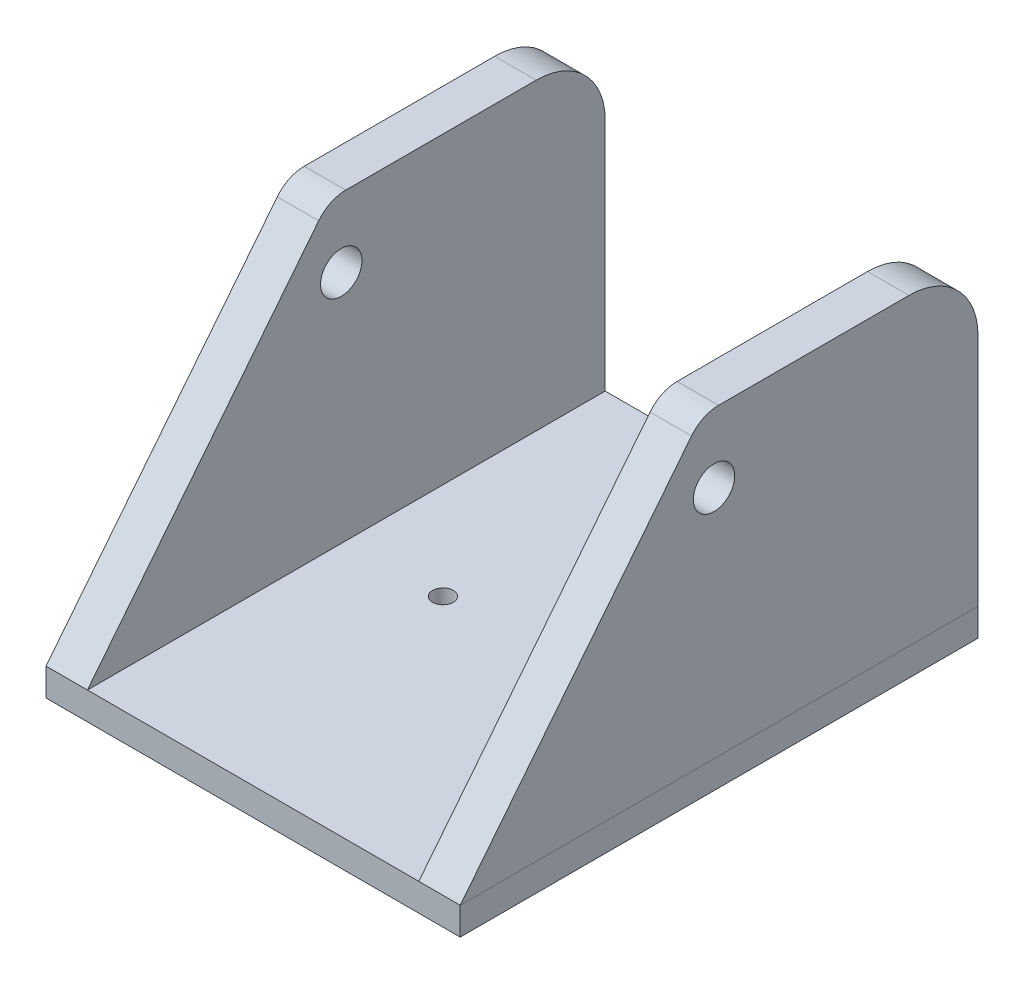
from build123d import *

# Parameters (mm, degrees)
SKETCH1_W               = 60
SKETCH1_H               = 75
BOSS_EXTRUDE1_DEPTH     = 4
CUT_EXTRUDE1_DEPTH      = 81.876448982
CUT_EXTRUDE1_DEPTH_BACK = 4
SKETCH2_R               = 1.5
SKETCH8_R               = 3
CUT_EXTRUDE2_DEPTH      = 74
FILLET3_R               = 5
FILLET4_R               = 10
SPLIT1_START            = 4
SPLIT1_OUTLINE_W        = 6
SPLIT1_OUTLINE_H        = 76
SPLIT1_DEPTH            = 44
SPLIT1_START_2          = -30
SPLIT1_2_OUTLINE_R      = 3
SPLIT1_2_DEPTH          = 6
SPLIT1_START_3          = 24
SPLIT1_3_OUTLINE_R      = 3
SPLIT1_3_DEPTH          = 6


# Read off the part's stored shape, not the designer's step: Split1
with BuildPart() as part:
    # Sketch1 → Boss-Extrude1 (new body)
    with BuildSketch(Plane(origin=(0, 0, 0), x_dir=(1, 0, 0), z_dir=(0, 1, 0))):
        with Locations((0, 37.5)):
            Rectangle(SKETCH1_W, SKETCH1_H)
    extrude(amount=BOSS_EXTRUDE1_DEPTH)

    # Sketch2 → Cut-Extrude1 (cut, two sides: drawn at the far end of the back side and taken through both)
    with BuildSketch(Plane(origin=(0, 4, 0), x_dir=(1, 0, 0), z_dir=(0, 1, 0)).offset(-CUT_EXTRUDE1_DEPTH_BACK)):
        with Locations(Location((-10, 37.5, 0), (0, 0, 90))):
            Circle(SKETCH2_R)
        with Locations(Location((10, 37.5, 0), (0, 0, 90))):
            Circle(SKETCH2_R)
    extrude(amount=CUT_EXTRUDE1_DEPTH + CUT_EXTRUDE1_DEPTH_BACK, mode=Mode.SUBTRACT)

    # Sketch3 → Loft1 section 0
    with BuildSketch(Plane(origin=(0, 4, 0), x_dir=(1, 0, 0), z_dir=(0, 1, 0))):
        with BuildLine():
            Line((30, 75), (24, 75))
            Line((24, 75), (24, 0))
            Line((24, 0), (30, 0))
            Line((30, 0), (30, 75))
        make_face()
    # Sketch4 → Loft1 section 1
    with BuildSketch(Plane(origin=(0, 48, 0), x_dir=(1, 0, 0), z_dir=(0, 1, 0))):
        with BuildLine():
            Line((24, 75), (24, 35))
            Line((24, 35), (30, 35))
            Line((30, 35), (30, 75))
            Line((30, 75), (24, 75))
        make_face()
    loft()

    # Sketch3<19> → Loft2 section 0
    with BuildSketch(Plane(origin=(0, 4, 0), x_dir=(1, 0, 0), z_dir=(0, 1, 0))):
        with BuildLine():
            Line((-30, 75), (-24, 75))
            Line((-24, 75), (-24, 0))
            Line((-24, 0), (-30, 0))
            Line((-30, 0), (-30, 75))
        make_face()
    # Sketch4<17> → Loft2 section 1
    with BuildSketch(Plane(origin=(0, 48, 0), x_dir=(1, 0, 0), z_dir=(0, 1, 0))):
        with BuildLine():
            Line((-24, 75), (-24, 35))
            Line((-24, 35), (-30, 35))
            Line((-30, 35), (-30, 75))
            Line((-30, 75), (-24, 75))
        make_face()
    loft()

    # Sketch8 → Cut-Extrude2 (cut)
    with BuildSketch(Plane.ZY.offset(30)):
        with Locations((-36.766552642, 38)):
            Circle(SKETCH8_R)
    extrude(amount=-CUT_EXTRUDE2_DEPTH, mode=Mode.SUBTRACT)

    # Fillet3
    fillet3_edges = [part.edges().sort_by_distance(p)[0] for p in [
        (27, 48, -35),
        (-27, 48, -35),
    ]]
    fillet(fillet3_edges, radius=FILLET3_R)

    # Fillet4
    fillet4_edges = [part.edges().sort_by_distance(p)[0] for p in [
        (-27, 48, -75),
        (27, 48, -75),
    ]]
    fillet(fillet4_edges, radius=FILLET4_R)

    # Split1 outline → Split1 (cut)
    with BuildSketch(Plane(origin=(0, 0, 0), x_dir=(1, 0, 0), z_dir=(0, 1, 0)).offset(SPLIT1_START)):
        with Locations((-27, 37)):
            Rectangle(SPLIT1_OUTLINE_W, SPLIT1_OUTLINE_H)
        with Locations((27, 37)):
            Rectangle(SPLIT1_OUTLINE_W, SPLIT1_OUTLINE_H)
    extrude(amount=SPLIT1_DEPTH, mode=Mode.SUBTRACT)


with BuildPart() as body_2:
    # Split1 2 outline → Split1 2 (new body)
    with BuildSketch(Plane.YZ.offset(SPLIT1_START_2)):
        with BuildLine():
            Line((4, 0), (4, -75))
            Line((4, -75), (38, -75))
            ThreePointArc((38, -75), (45.071067812, -72.071067812), (48, -65))
            Line((48, -65), (48, -37.411678544))
            ThreePointArc((48, -37.411678544), (47.503503589, -35.239477948), (46.112617829, -33.498673273))
            Line((46.112617829, -33.498673273), (4, 0))
        make_face()
        with Locations((38, -36.766552642)):
            Circle(SPLIT1_2_OUTLINE_R, mode=Mode.SUBTRACT)
    extrude(amount=SPLIT1_2_DEPTH)


with BuildPart() as body_3:
    # Split1 3 outline → Split1 3 (new body)
    with BuildSketch(Plane.YZ.offset(SPLIT1_START_3)):
        with BuildLine():
            Line((4, 0), (4, -75))
            Line((4, -75), (38, -75))
            ThreePointArc((38, -75), (45.071067812, -72.071067812), (48, -65))
            Line((48, -65), (48, -37.411678544))
            ThreePointArc((48, -37.411678544), (47.503503589, -35.239477948), (46.112617829, -33.498673273))
            Line((46.112617829, -33.498673273), (4, 0))
        make_face()
        with Locations((38, -36.766552642)):
            Circle(SPLIT1_3_OUTLINE_R, mode=Mode.SUBTRACT)
    extrude(amount=SPLIT1_3_DEPTH)


solid = Compound([part.part, body_2.part, body_3.part])
